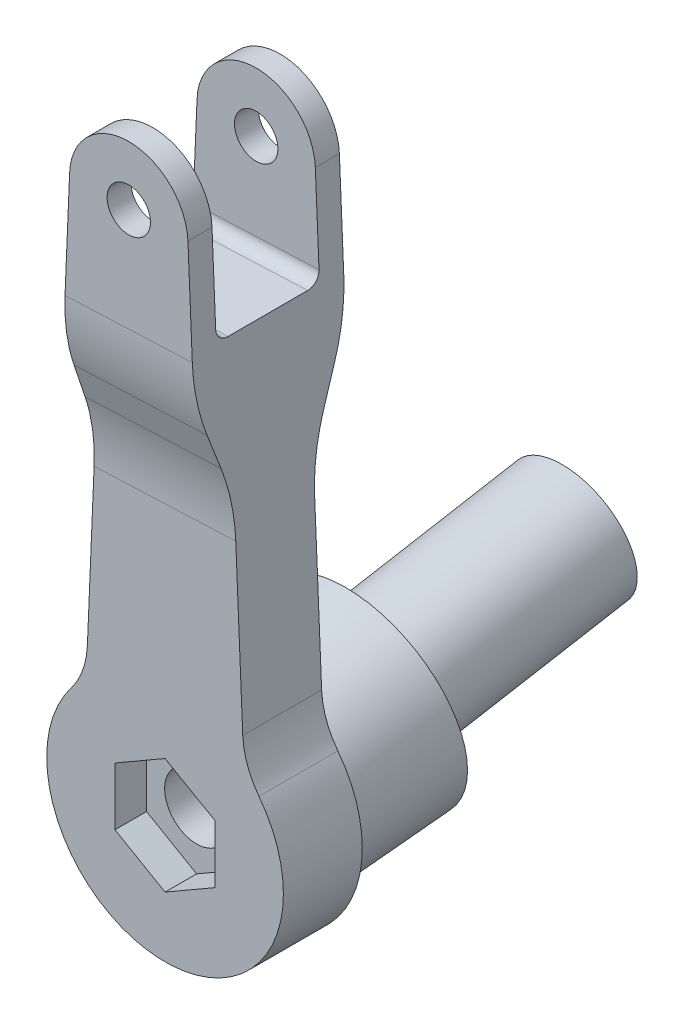
from build123d import *

# Parameters (mm, degrees)
SKETCH1_R               = 2.75
BOSS_EXTRUDE1_DEPTH     = 19.2
CUT_EXTRUDE4_DEPTH      = 84.275329734
CUT_EXTRUDE4_DEPTH_BACK = 84.275329734
SKETCH13_OUTSIDE_W      = 41
SKETCH13_OUTSIDE_H      = 115.36
CUT_EXTRUDE2_DEPTH      = 4
SKETCH4_R               = 4.05
CUT_EXTRUDE3_DEPTH      = 20
FILLET4_R               = 10
BOSS_EXTRUDE2_REACH     = 83.7
SKETCH9_R               = 13
SKETCH10_R              = 8
BOSS_EXTRUDE3_DEPTH     = 27
DRAFT1_ANGLE            = -3
FILLET5_R               = 25
SKETCH14_R              = 2
CUT_EXTRUDE5_DEPTH      = 4
FILLET6_R               = 1.5


with BuildPart() as part:
    # Sketch1 → Boss-Extrude1 (new body)
    with BuildSketch(Plane.XY):
        with BuildLine():
            Line((-7.5, 70.183778092), (-10, 11.180339887))
            ThreePointArc((-10, 11.180339887), (0, -15), (10, 11.180339887))
            Line((10, 11.180339887), (7.5, 70.183778092))
            ThreePointArc((7.5, 70.183778092), (0, 77.372729176), (-7.5, 70.183778092))
        make_face()
        with Locations((0, 69.866)):
            Circle(SKETCH1_R, mode=Mode.SUBTRACT)
    extrude(amount=BOSS_EXTRUDE1_DEPTH)

    # Sketch13 outside → Cut-Extrude4 (cut, two sides: drawn at the far end of the back side and taken through both)
    with BuildSketch(Plane(origin=(10.454946348, 0.442980387, 0), x_dir=(0, 0, -1), z_dir=(0.9991035808766652, 0.042332430587259585, 0)).offset(-CUT_EXTRUDE4_DEPTH_BACK)):
        with Locations((-9.6, 31.158)):
            Rectangle(SKETCH13_OUTSIDE_W, SKETCH13_OUTSIDE_H)
        Polygon((-16.15, 77.310099957), (-16.15, 57.310099957), (-3.05, 57.310099957), (-3.05, 77.310099957), (0, 77.310099957), (0, 52.310099957), (-4.6, 39.671703828), (-4.6, -15), (-14.6, -15), (-14.6, 39.671703828), (-19.2, 52.310099957), (-19.2, 77.310099957), align=None, mode=Mode.SUBTRACT)
    extrude(amount=CUT_EXTRUDE4_DEPTH + CUT_EXTRUDE4_DEPTH_BACK, mode=Mode.SUBTRACT)

    # Sketch3 → Cut-Extrude2 (cut)
    with BuildSketch(Plane.XY.offset(14.6)):
        Polygon((0, 7.332348419), (-6.35, 3.666174209), (-6.35, -3.666174209), (0, -7.332348419), (6.35, -3.666174209), (6.35, 3.666174209), align=None)
    extrude(amount=-CUT_EXTRUDE2_DEPTH, mode=Mode.SUBTRACT)

    # Sketch4 → Cut-Extrude3 (cut)
    with BuildSketch(Plane.XY.offset(10.6)):
        Circle(SKETCH4_R)
    extrude(amount=-CUT_EXTRUDE3_DEPTH, mode=Mode.SUBTRACT)

    # Fillet4
    fillet4_edges = [part.edges().sort_by_distance(p)[0] for p in [
        (-10, 11.180339887, 9.6),
        (10, 11.180339887, 9.6),
    ]]
    fillet(fillet4_edges, radius=FILLET4_R)

    # Boss-Extrude2: up to this plane
    boss_extrude2_end = Plane(origin=(-17.286936373, 38.974843589, 4.6), z_dir=(0, 0, -1))
    # Sketch9 → Boss-Extrude2 (add, up to the surface)
    with BuildSketch(Plane(origin=(0, 2.715435503, -10.4), x_dir=(-1, 0, 0), z_dir=(0, 0.17364817766692367, -0.9848077530122092)), mode=Mode.PRIVATE) as boss_extrude2_sk1:
        with Locations((0, -0.868240888)):
            Circle(SKETCH9_R)
    boss_extrude2_tool1 = split(extrude(boss_extrude2_sk1.sketch, amount=-BOSS_EXTRUDE2_REACH, mode=Mode.PRIVATE), bisect_by=boss_extrude2_end, keep=Keep.BOTH, mode=Mode.PRIVATE)
    add(boss_extrude2_tool1.solids().sort_by_distance((0, 1.860385, -10.550768))[0])

    # Sketch10 → Boss-Extrude3 (add)
    with BuildSketch(Plane(origin=(0, 1.860385145, -10.550768448), x_dir=(-1, 0, 0), z_dir=(0, 0.17364817766692367, -0.9848077530122092))):
        Circle(SKETCH10_R)
    extrude(amount=BOSS_EXTRUDE3_DEPTH)

    # Draft1
    draft1_faces = [part.faces().sort_by_distance(p)[0] for p in [
        (13, 0.320865392, -1.819718062),
    ]]
    draft(draft1_faces, Plane(origin=(0, 1.860385145, -10.550768448), x_dir=(0, -0.9848077530122092, -0.17364817766692367), z_dir=(0, 0.17364817766692367, -0.9848077530122092)), DRAFT1_ANGLE)

    # Fillet5
    fillet5_edges = [part.edges().sort_by_distance(p)[0] for p in [
        (-0.014820438, 52.356405855, 0),
        (-0.01578265, 39.706629492, 4.6),
        (-0.01578265, 39.706629492, 14.6),
        (-0.014820438, 52.356405855, 19.2),
    ]]
    fillet(fillet5_edges, radius=FILLET5_R)

    # Sketch14 → Cut-Extrude5 (cut)
    with BuildSketch(Plane(origin=(0, 6.548885942, -37.140577779), x_dir=(-1, 0, 0), z_dir=(0, 0.17364817766692367, -0.9848077530122092))):
        with Locations((-3.464101615, 2)):
            Circle(SKETCH14_R)
        with Locations((3.464101615, 2)):
            Circle(SKETCH14_R)
        with Locations((0, -4)):
            Circle(SKETCH14_R)
    extrude(amount=-CUT_EXTRUDE5_DEPTH, mode=Mode.SUBTRACT)

    # Fillet6
    fillet6_edges = [part.edges().sort_by_distance(p)[0] for p in [
        (12.193732862, -0.582245771, 4.6),
        (-0.014439768, 57.360908102, 3.05),
        (-0.014439768, 57.360908102, 16.15),
    ]]
    fillet(fillet6_edges, radius=FILLET6_R)


solid = part.part
